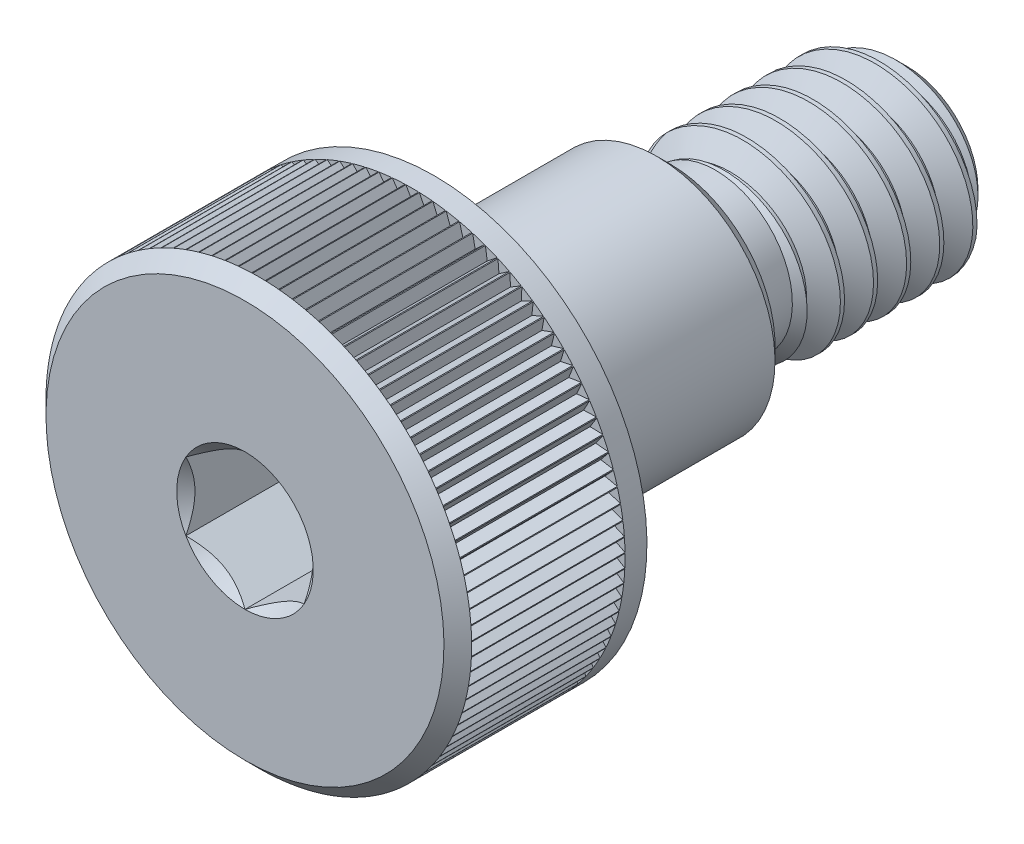
from build123d import *
from build123d.topology import SkipClean

# Parameters (mm, degrees)
SKETCH12_W         = 0.5
SKETCH12_H         = 0.6
CHAMFER3_SIZE      = 0.1625
CHAMFER1_SIZE      = 0.5
CHAMFER2_SIZE      = 0.2925
CUT_EXTRUDE2_DEPTH = 2
CUT_SWEEP1_PITCH   = 0.7
SKETCH14_W         = 0.95
SKETCH14_H         = 1.625
CUT_EXTRUDE5_DEPTH = 3.24425
CIRPATTERN1_COUNT  = 99


with BuildPart() as part:
    # Sketch1 → Revolve1 (revolve)
    with BuildSketch(Plane(origin=(0, 0, 0), x_dir=(0, 0, -1), z_dir=(1, 0, 0))):
        Polygon((-7, 4.5), (-3, 4.5), (-3, 2.5), (2, 2.5), (2, 2), (7, 2), (7, 0), (-7, 0), align=None)
    revolve(axis=Axis((0, 0, -7), (0, 0, 1)))

    # Sketch12 → Cut-Revolve2 (revolve, cut)
    with BuildSketch(Plane(origin=(0, 0, 0), x_dir=(0, 0, -1), z_dir=(1, 0, 0))):
        with Locations((-2.75, 2.2)):
            Rectangle(SKETCH12_W, SKETCH12_H)
    revolve(axis=Axis((0, 0, -7), (0, 0, 1)), mode=Mode.SUBTRACT)

    # Chamfer3
    chamfer3_edges = [part.edges().sort_by_distance(p)[0] for p in [
        (0, -1.9, 2.5),
        (0, -2.5, 2.5),
    ]]
    chamfer(chamfer3_edges, length=CHAMFER3_SIZE)

    # Sketch5 → Cut-Revolve1 (revolve, cut)
    with BuildSketch(Plane(origin=(0, 0, 0), x_dir=(0, 0, -1), z_dir=(1, 0, 0))):
        with BuildLine():
            Line((2, 2.5), (3.825, 2.5))
            Line((3.825, 2.5), (2.95, 1.625))
            Line((2.95, 1.625), (2.375, 1.625))
            ThreePointArc((2.375, 1.625), (2.109834957, 1.734834957), (2, 2))
            Line((2, 2), (2, 2.5))
        make_face()
    revolve(axis=Axis((0, 0, -7), (0, 0, 1)), mode=Mode.SUBTRACT)

    # Chamfer1
    chamfer1_edges = [part.edges().sort_by_distance(p)[0] for p in [
        (0, -2, -7),
    ]]
    chamfer(chamfer1_edges, length=CHAMFER1_SIZE)

    # Chamfer2
    chamfer2_edges = [part.edges().sort_by_distance(p)[0] for p in [
        (0, -2.5, -2),
        (0, -4.5, 7),
    ]]
    chamfer(chamfer2_edges, length=CHAMFER2_SIZE)

    # Sketch8 → Cut-Extrude2 (cut)
    with BuildSketch(Plane.XY.offset(7)):
        Polygon((1.25, 0.721687836), (0, 1.443375673), (-1.25, 0.721687836), (-1.25, -0.721687836), (0, -1.443375673), (1.25, -0.721687836), align=None)
    extrude(amount=-CUT_EXTRUDE2_DEPTH, mode=Mode.SUBTRACT)

    # Cut-Extrude4 cone 1 section (through the dimple's axis) → Cut-Extrude4 (revolve, cut)
    with BuildSketch(Plane(origin=(0, 0, 7), x_dir=(0, -1, 0), z_dir=(1, 0, 0))):
        Polygon((0, 0), (1.443375673, 0), (0, 1.443375673), align=None)
    revolve(axis=Axis((0, 0, 7), (0, 0, -1)), mode=Mode.SUBTRACT)

    # Cut-Sweep1: the profile of Sketch4 profile screwed along a right-hand helix of 6.785714 turns, 6 arcs to a turn; built about Z, then put on its axis
    cut_sweep1_z = Axis((0, 0, 0), (0, 0, 1))
    cut_sweep1_corners = [(2.0003, 0, 0.000173205), (2.0003, 0, -0.612673205), (1.545336663, 0, -0.35), (1.545336663, 0, -0.2625)]
    with BuildLine(mode=Mode.PRIVATE) as cut_sweep1_profile:
        Line(cut_sweep1_corners[0], cut_sweep1_corners[1])
        Line(cut_sweep1_corners[1], cut_sweep1_corners[2])
        Line(cut_sweep1_corners[2], cut_sweep1_corners[3])
        Line(cut_sweep1_corners[3], cut_sweep1_corners[0])
    cut_sweep1_cap = Face(cut_sweep1_profile.wire())
    cut_sweep1_turn_angles = [0, 30, 60, 90, 120, 150, 180, 210, 240, 270, 300, 330, 360]
    cut_sweep1_turn_weights = [1, 0.8660254037844387, 1, 0.8660254037844387, 1, 0.8660254037844387, 1, 0.8660254037844387, 1, 0.8660254037844387, 1, 0.8660254037844387, 1]
    cut_sweep1_turn_rails = [Edge.make_bspline([Vector(p[0], p[1], 0).rotate(cut_sweep1_z, cut_sweep1_turn_angles[k]) / cut_sweep1_turn_weights[k] + Vector(0, 0, p[2] + CUT_SWEEP1_PITCH * cut_sweep1_turn_angles[k] / 360) for k in range(13)], [0, 0, 0, 1, 1, 2, 2, 3, 3, 4, 4, 5, 5, 6, 6, 6], 2, cut_sweep1_turn_weights) for p in cut_sweep1_corners]
    cut_sweep1_turn_sides = [Face.make_surface_from_curves(cut_sweep1_turn_rails[p[0]], cut_sweep1_turn_rails[p[1]]) for p in [(0, 1), (1, 2), (2, 3), (3, 0)]]
    cut_sweep1_last_angles = [2160, 2190, 2220, 2250, 2280, 2310, 2340, 2370, 2400, 2421.428571429, 2442.857142857]
    cut_sweep1_last_weights = [1, 0.8660254037844387, 1, 0.8660254037844387, 1, 0.8660254037844387, 1, 0.8660254037844387, 1, 0.9308737486442035, 1]
    cut_sweep1_last_rails = [Edge.make_bspline([Vector(p[0], p[1], 0).rotate(cut_sweep1_z, cut_sweep1_last_angles[k]) / cut_sweep1_last_weights[k] + Vector(0, 0, p[2] + CUT_SWEEP1_PITCH * cut_sweep1_last_angles[k] / 360) for k in range(11)], [0, 0, 0, 1, 1, 2, 2, 3, 3, 4, 4, 5, 5, 5], 2, cut_sweep1_last_weights) for p in cut_sweep1_corners]
    cut_sweep1_last_sides = [Face.make_surface_from_curves(cut_sweep1_last_rails[p[0]], cut_sweep1_last_rails[p[1]]) for p in [(0, 1), (1, 2), (2, 3), (3, 0)]]
    cut_sweep1 = Plane(origin=(0, 0, -7), x_dir=(0, 1, 0), z_dir=(0, 0, 1)) * Solid(Shell([*[p.moved(Location((0, 0, CUT_SWEEP1_PITCH * i))) for i in range(6) for p in cut_sweep1_turn_sides], *cut_sweep1_last_sides, cut_sweep1_cap, cut_sweep1_cap.rotate(cut_sweep1_z, 2442.857142857).moved(Location((0, 0, CUT_SWEEP1_PITCH * 2442.857142857 / 360)))]))
    add(cut_sweep1, mode=Mode.SUBTRACT)

    # Sketch14 → Revolve2 (revolve)
    with SkipClean():  # the faces are left unmerged after this step: merging them gives an invalid solid
        with BuildSketch(Plane(origin=(0, 0, 0), x_dir=(0, 0, -1), z_dir=(1, 0, 0)), mode=Mode.PRIVATE) as revolve2_sk:
            with Locations((2.475, 0.8125)):
                Rectangle(SKETCH14_W, SKETCH14_H)
        revolve(revolve2_sk.sketch.rotate(Axis((0, 0, -7), (0, 0, 1)), 157.96684057), axis=Axis((0, 0, -7), (0, 0, 1)))

    # Sketch11 → Cut-Extrude5 (cut)
    with SkipClean():  # the faces are left unmerged after this step: merging them gives an invalid solid
        with BuildSketch(Plane.XY.offset(6.7075)):
            Polygon((0, 4.266), (0.135099963, 4.5), (-0.135099963, 4.5), align=None)
        cut_extrude5 = extrude(amount=-CUT_EXTRUDE5_DEPTH, mode=Mode.SUBTRACT)

    # CirPattern1: Cut-Extrude5 ×99 about axis
    with SkipClean():  # the faces are left unmerged after this step: merging them gives an invalid solid
        cirpattern1_axis = Axis((0, 0, 0), (0, 0, 1))
        for i in range(1, CIRPATTERN1_COUNT):
            add(cut_extrude5.rotate(cirpattern1_axis, i * 360 / CIRPATTERN1_COUNT), mode=Mode.SUBTRACT)


solid = part.part
